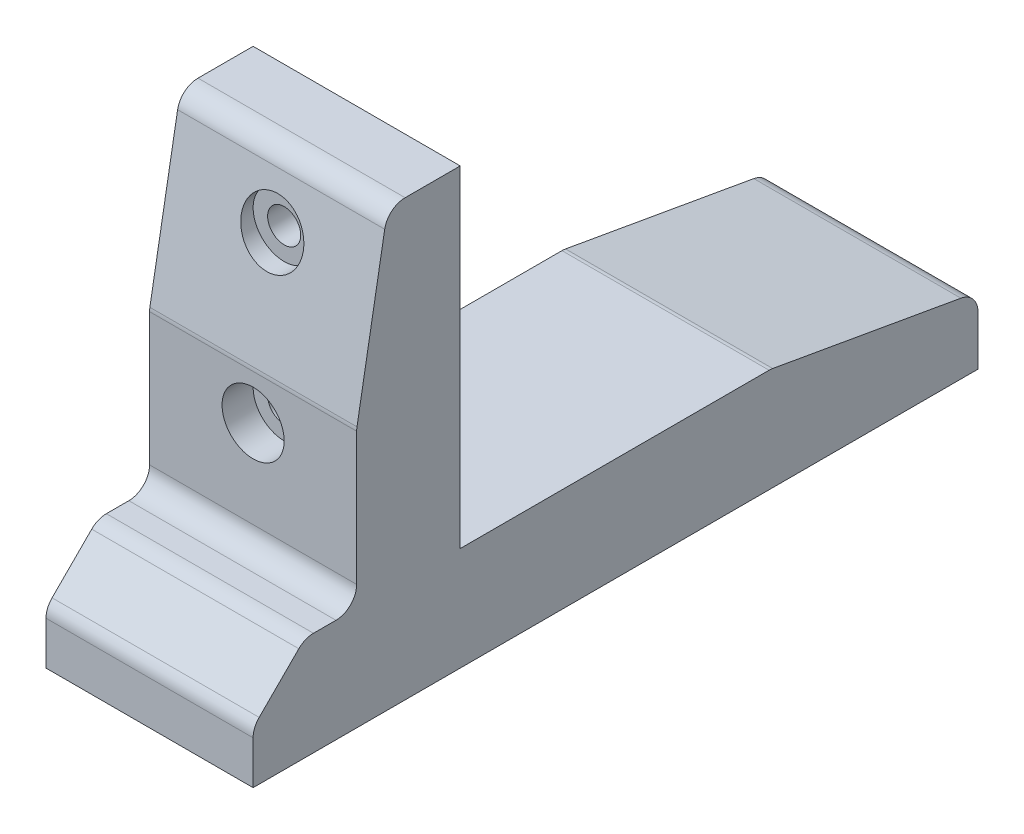
from build123d import *

# Parameters (mm, degrees)
SKETCH3_W           = 10
SKETCH3_H           = 32
BOSS_EXTRUDE1_DEPTH = 10
SKETCH4_R           = 1.6
CUT_EXTRUDE1_DEPTH  = 106.045434916
CUT_EXTRUDE2_START  = -7
SKETCH4_3_R         = 3
SKETCH4_3_R_2       = 1.6
CUT_EXTRUDE2_DEPTH  = 3
CHAMFER1_SIZE       = 20
CHAMFER1_SIZE2      = 3.526539614
CHAMFER2_SIZE       = 5
CHAMFER3_SIZE       = 17.013845459
CHAMFER3_SIZE_2     = 3
FILLET1_R           = 2


with BuildPart() as part:
    # Sketch3 → Boss-Extrude1 (new, symmetric)
    with BuildSketch(Plane(origin=(37.122691811, 0, 0), x_dir=(0, 0, -1), z_dir=(1, 0, 0))):
        Polygon((50, -69.46065261), (0, -69.46065261), (-10, -69.46065261), (-20, -69.46065261), (-20, -79.46065261), (50, -79.46065261), align=None)
        with Locations((-5, -53.46065261)):
            Rectangle(SKETCH3_W, SKETCH3_H)
    extrude(amount=BOSS_EXTRUDE1_DEPTH, both=True)

    # Sketch4 → Cut-Extrude1 (cut, through all)
    with BuildSketch(Plane(origin=(0, 0, 0), x_dir=(-1, 0, 0), z_dir=(0, 0, -1))):
        with Locations(Location((-37.122691811, -43.96065261, 0), (0, 0, 90))):
            Circle(SKETCH4_R)
        with Locations(Location((-37.122691811, -58.96065261, 0), (0, 0, 90))):
            Circle(SKETCH4_R)
    extrude(amount=-CUT_EXTRUDE1_DEPTH, mode=Mode.SUBTRACT)

    # Sketch4<3> → Cut-Extrude2 (cut)
    # profile 1 of 2: a face of its own
    with BuildSketch(Plane(origin=(0, 0, 0), x_dir=(-1, 0, 0), z_dir=(0, 0, -1)).offset(CUT_EXTRUDE2_START)):
        with Locations(Location((-37.122691811, -43.96065261, 0), (0, 0, 90))):
            Circle(SKETCH4_3_R)
        with Locations(Location((-37.122691811, -43.96065261, 0), (0, 0, 90))):
            Circle(SKETCH4_3_R_2, mode=Mode.SUBTRACT)
    # profile 2 of 2: a face of its own
    with BuildSketch(Plane(origin=(0, 0, 0), x_dir=(-1, 0, 0), z_dir=(0, 0, -1)).offset(CUT_EXTRUDE2_START)):
        with Locations(Location((-37.122691811, -58.96065261, 0), (0, 0, 90))):
            Circle(SKETCH4_3_R)
        with Locations(Location((-37.122691811, -58.96065261, 0), (0, 0, 90))):
            Circle(SKETCH4_3_R_2, mode=Mode.SUBTRACT)
    extrude(amount=-CUT_EXTRUDE2_DEPTH, mode=Mode.SUBTRACT)

    # Chamfer1
    chamfer1_edges = [part.edges().sort_by_distance(p)[0] for p in [
        (37.122691811, -69.46065261, -50),
    ]]
    chamfer1_side = [part.faces().sort_by_distance(p)[0] for p in [
        (37.122691811, -69.46065261, -25),
    ]]
    chamfer(chamfer1_edges, length=CHAMFER1_SIZE, length2=CHAMFER1_SIZE2, reference=chamfer1_side[0])

    # Chamfer2
    chamfer2_edges = [part.edges().sort_by_distance(p)[0] for p in [
        (37.122691811, -69.46065261, 20),
    ]]
    chamfer(chamfer2_edges, length=CHAMFER2_SIZE)

    # Chamfer3
    # the kernel refuses this chamfer: 17.013845459, 3 mm, written as the material it takes off along each edge
    with BuildSketch(Plane(origin=(-17.08844569, -37.46065261, 10), x_dir=(0, -0.9999776716360548, 0.006682531656101368), z_dir=(1, 0, 0))) as chamfer3_piece_1:
        Polygon((CHAMFER3_SIZE * 0.999977671627, CHAMFER3_SIZE * 0.00668253165604), (-CHAMFER3_SIZE_2 * 0.0066825316561, CHAMFER3_SIZE_2 * 0.999977671636), (0, 0), align=None)
    extrude(amount=108.422275002, mode=Mode.SUBTRACT)

    # Fillet1
    fillet1_edges = [part.edges().sort_by_distance(p)[0] for p in [
        (37.122691811, -69.46065261, 10),
        (37.122691811, -69.46065261, -30),
        (37.122691811, -72.987192224, -50),
        (37.122691811, -74.46065261, 20),
        (37.122691811, -69.46065261, 15),
        (37.122691811, -54.474498068, 10),
        (37.122691811, -37.46065261, 7),
    ]]
    fillet(fillet1_edges, radius=FILLET1_R)


solid = part.part
